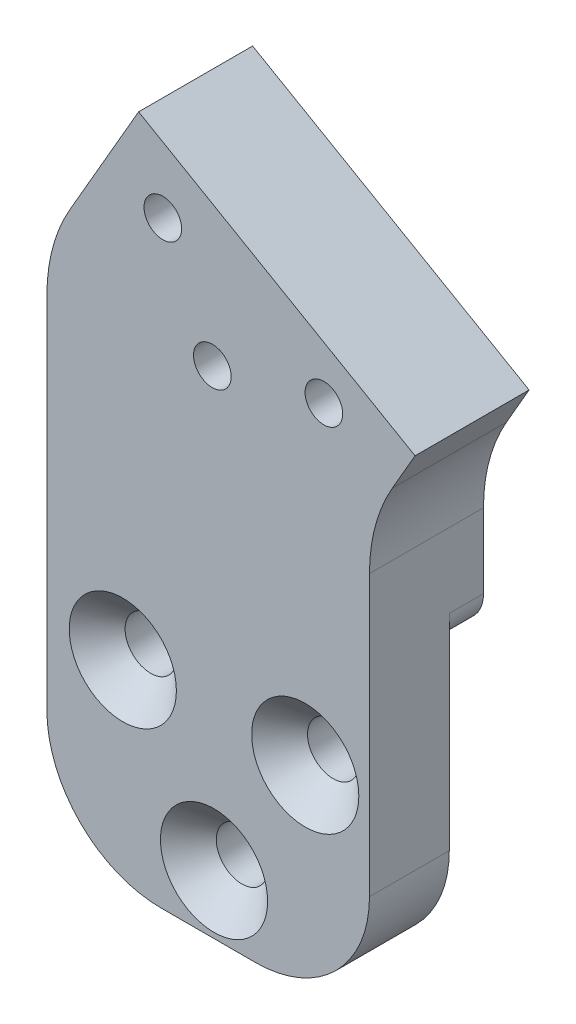
from build123d import *

# Parameters (mm, degrees)
BOSS_EXTRUDE1_DEPTH                                 = 9
BOSS_EXTRUDE1_DEPTH_BACK                            = 1
CUT_EXTRUDE1_DEPTH                                  = 3
CSK_FOR_M4_COUNTERSUNK_FLAT_HEAD_SCREW2_D           = 4.5
CSK_FOR_M4_COUNTERSUNK_FLAT_HEAD_SCREW2_CSINK_D     = 9.4
CSK_FOR_M4_COUNTERSUNK_FLAT_HEAD_SCREW2_CSINK_ANGLE = 90
FILLET1_R                                           = 15
FILLET2_R                                           = 10
FILLET3_R                                           = 3
SKETCH12_R                                          = 1.65
CUT_EXTRUDE2_DEPTH                                  = 181.248579312


with BuildPart() as part:
    # Sketch1 → Boss-Extrude1 (new, two sides: drawn at the far end of the back side and taken through both)
    with BuildSketch(Plane.XY.offset(-BOSS_EXTRUDE1_DEPTH_BACK)):
        Polygon((-14.65789802, 119.616999761), (13.633055873, 119.616999761), (13.633055873, 139.616999761), (13.633055873, 158.176865611), (17.633055873, 165.105068841), (-6.615655433, 179.105068841), (-10.615655433, 172.176865611), (-14.65789802, 165.175496074), (-14.65789802, 158.176865611), (-14.65789802, 139.616999761), align=None)
    extrude(amount=BOSS_EXTRUDE1_DEPTH + BOSS_EXTRUDE1_DEPTH_BACK)

    # Sketch3 → Cut-Extrude1 (cut)
    with BuildSketch(Plane(origin=(0, 0, -1), x_dir=(-1, 0, 0), z_dir=(0, 0, -1))):
        with BuildLine():
            Line((-15, 144.248115566), (-15, 114.785930714))
            Line((-15, 114.785930714), (15, 114.785930714))
            Line((15, 114.785930714), (15, 144.248115566))
            ThreePointArc((15, 144.248115566), (0, 145), (-15, 144.248115566))
        make_face()
    extrude(amount=-CUT_EXTRUDE1_DEPTH, mode=Mode.SUBTRACT)

    # CSK for M4 Countersunk Flat Head Screw2 (through all)
    with Locations(Plane.XY.offset(9)):
        with Locations((0, 0), (8, 136.785930714), (-8, 136.785930714), (0, 124.785930714)):
            CounterSinkHole(CSK_FOR_M4_COUNTERSUNK_FLAT_HEAD_SCREW2_D / 2, CSK_FOR_M4_COUNTERSUNK_FLAT_HEAD_SCREW2_CSINK_D / 2, counter_sink_angle=CSK_FOR_M4_COUNTERSUNK_FLAT_HEAD_SCREW2_CSINK_ANGLE)

    # Fillet1
    fillet1_edges = [part.edges().sort_by_distance(p)[0] for p in [
        (13.633055873, 158.176865611, 4),
        (-14.65789802, 165.175496074, 4),
    ]]
    fillet(fillet1_edges, radius=FILLET1_R)

    # Fillet2
    fillet2_edges = [part.edges().sort_by_distance(p)[0] for p in [
        (-14.65789802, 119.616999761, 5.5),
        (13.633055873, 119.616999761, 5.5),
    ]]
    fillet(fillet2_edges, radius=FILLET2_R)

    # Fillet3
    fillet3_edges = [part.edges().sort_by_distance(p)[0] for p in [
        (13.633055873, 144.379181239, 0.5),
        (-14.65789802, 144.282102161, 0.5),
    ]]
    fillet(fillet3_edges, radius=FILLET3_R)

    # Sketch12 → Cut-Extrude2 (cut, through all)
    with BuildSketch(Plane(origin=(0, 0, -1), x_dir=(-1, 0, 0), z_dir=(0, 0, -1))):
        with Locations((4.49129978, 172.105068841)):
            Circle(SKETCH12_R)
        with Locations((-9.633055873, 165.105068841)):
            Circle(SKETCH12_R)
        with Locations((0.146785414, 163.038543864)):
            Circle(SKETCH12_R)
    extrude(amount=-CUT_EXTRUDE2_DEPTH, mode=Mode.SUBTRACT)


solid = part.part
